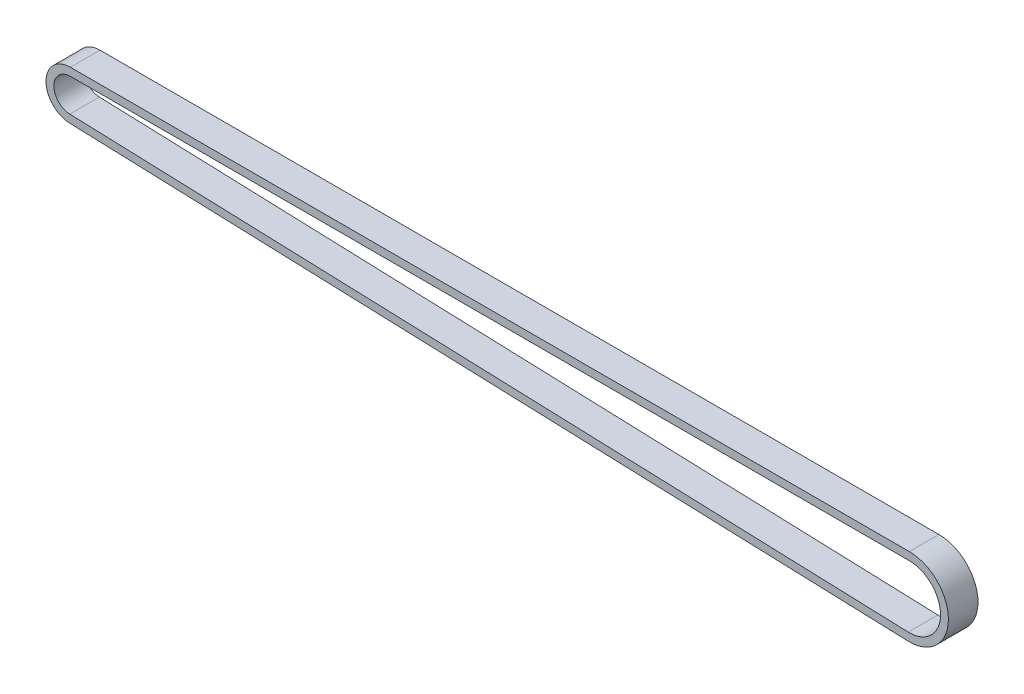
from build123d import *

# Parameters (mm, degrees)
BOSS_EXTRUDE1_DEPTH = 9.525


with BuildPart() as part:
    # Sketch1 → Boss-Extrude1 (new body)
    with BuildSketch(Plane.XY):
        with BuildLine():
            Line((0, 7.8486), (269.958663585, 7.8486))
            ThreePointArc((269.958663585, 7.8486), (282.529738686, -4.94439956), (269.518731828, -17.289700993))
            Line((269.518731828, -17.289700993), (-0.274624067, -7.843793953))
            ThreePointArc((-0.274624067, -7.843793953), (-7.847398396, 0.137333059), (0, 7.8486))
        make_face()
        with BuildLine():
            Line((0, 5.3086), (269.958663585, 5.3086))
            ThreePointArc((269.958663585, 5.3086), (279.990127555, -4.899955204), (269.60760693, -14.751256348))
            Line((269.60760693, -14.751256348), (-0.185748964, -5.305349308))
            ThreePointArc((-0.185748964, -5.305349308), (-5.307787265, 0.092888703), (0, 5.3086))
        make_face(mode=Mode.SUBTRACT)
    extrude(amount=BOSS_EXTRUDE1_DEPTH)


solid = part.part
